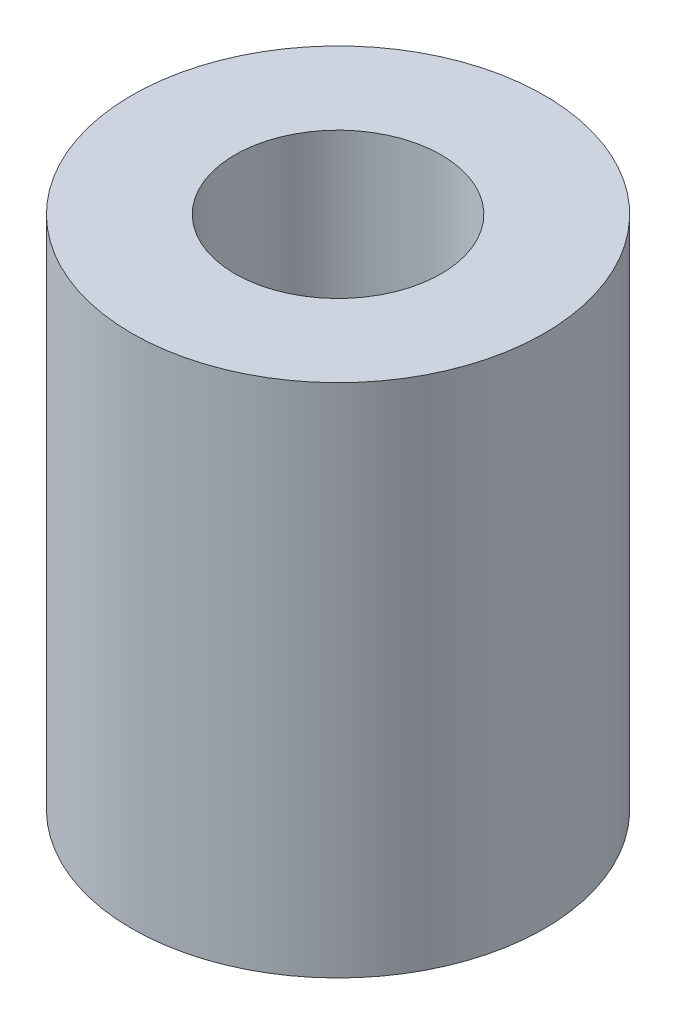
from build123d import *

# Parameters (mm, degrees)
SKETCH2_R           = 3
SKETCH2_R_2         = 1.5
BOSS_EXTRUDE1_DEPTH = 7.5


with BuildPart() as part:
    # Sketch2 → Boss-Extrude1 (new body)
    with BuildSketch(Plane(origin=(0, 0, 0), x_dir=(1, 0, 0), z_dir=(0, 1, 0))):
        with Locations((0, -0.018523637)):
            Circle(SKETCH2_R)
        with Locations((0, -0.018523637)):
            Circle(SKETCH2_R_2, mode=Mode.SUBTRACT)
    extrude(amount=BOSS_EXTRUDE1_DEPTH)


solid = part.part
